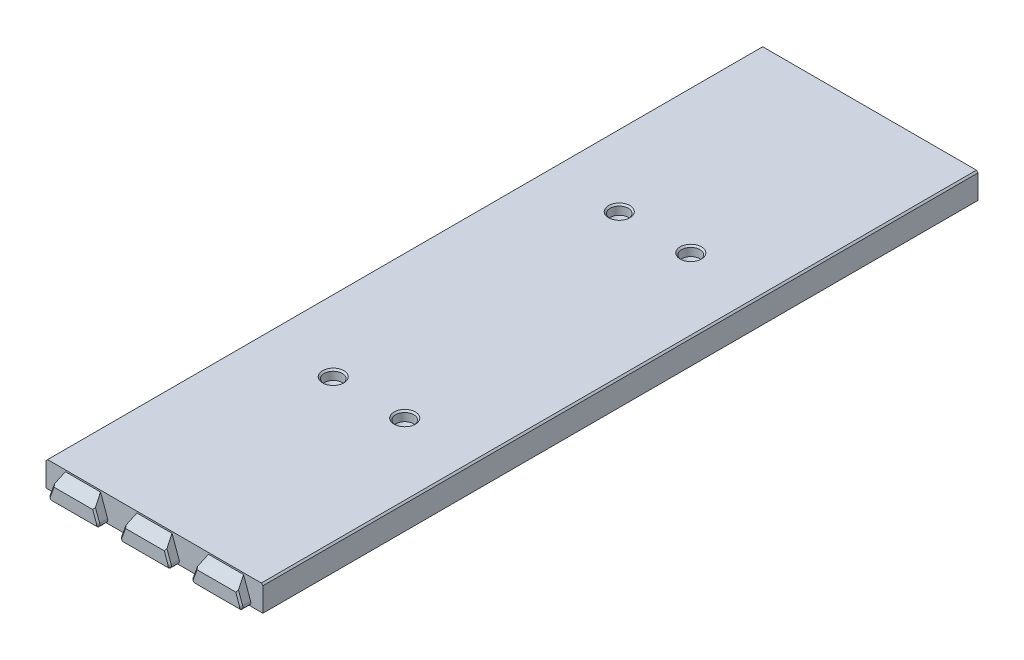
from build123d import *

# Parameters (mm, degrees)
BOSS_EXTRUDE1_DEPTH             = 112.5
SKETCH7_W                       = 64.25
SKETCH7_H                       = 6
BOSS_EXTRUDE7_DEPTH             = 1
BOSS_EXTRUDE4_DEPTH             = 3
BOSS_EXTRUDE8_REACH             = 119.834
BOSS_EXTRUDE8_DIRECTION_2_DEPTH = 2
CHAMFER4_SIZE                   = 0.5
FILLET4_R                       = 1
CHAMFER6_SIZE                   = 0.5
FILLET2_R                       = 2
CHAMFER4_OF_MIRROR2_SIZE        = 0.5
FILLET4_OF_MIRROR2_R            = 1
CHAMFER6_OF_MIRROR2_SIZE        = 0.5
FILLET2_OF_MIRROR2_R            = 2
BOSS_EXTRUDE9_REACH             = 232.678
SKETCH9_R                       = 5
FILLET3_R                       = 3
SKETCH10_R                      = 1.85
CUT_EXTRUDE2_DEPTH              = 231.678381356
SKETCH11_R                      = 2.85
CUT_EXTRUDE3_DEPTH              = 3
CHAMFER7_SIZE                   = 1
CUT_EXTRUDE4_DEPTH              = 231.678381356
CUT_EXTRUDE4_DEPTH_BACK         = 231.678381356
CHAMFER8_SIZE                   = 0.5


with BuildPart() as part:
    # Sketch1 → Boss-Extrude1 (new body)
    with BuildSketch(Plane.XY):
        Polygon((-34.125, 0), (-34.125, 8), (34.125, 8), (34.125, 0), (32.125, 0), (32.125, 6), (-32.125, 6), (-32.125, 0), align=None)
    boss_extrude1 = extrude(amount=-BOSS_EXTRUDE1_DEPTH)

    # Sketch7 → Boss-Extrude7 (add)
    with BuildSketch(Plane.XY):
        with Locations((0, 3)):
            Rectangle(SKETCH7_W, SKETCH7_H)
    boss_extrude7 = extrude(amount=-BOSS_EXTRUDE7_DEPTH)

    # Sketch2 → Boss-Extrude4 (add)
    with BuildSketch(Plane.XY):
        Polygon((17.161761874, 8), (14.25, 0), (30.75, 0), (27.838238126, 8), align=None)
        Polygon((-5.338238126, 8), (-8.25, 0), (8.25, 0), (5.338238126, 8), align=None)
        Polygon((-27.838238126, 8), (-30.75, 0), (-14.25, 0), (-17.161761874, 8), align=None)
    boss_extrude4 = extrude(amount=BOSS_EXTRUDE4_DEPTH)

    # Sketch8 → Boss-Extrude8 (add, up to next)
    with BuildSketch(Plane.XZ, mode=Mode.PRIVATE) as boss_extrude8_sk1:
        Polygon((-32.6, -24.741658736), (-32.6, -20.258341264), (-28.9, -21.605031131), (-28.9, -23.394968869), align=None)
    boss_extrude8_tool1 = extrude(boss_extrude8_sk1.sketch, amount=-BOSS_EXTRUDE8_REACH, mode=Mode.PRIVATE) - part.part
    # Sketch8 → Boss-Extrude8 (add, up to next)
    with BuildSketch(Plane.XZ, mode=Mode.PRIVATE) as boss_extrude8_sk2:
        Polygon((-32.6, -112.35), (-32.6, -110.258341264), (-28.9, -111.605031131), (-28.9, -112.35), (-28.9, -112.5), (-32.6, -112.5), align=None)
    boss_extrude8_tool2 = extrude(boss_extrude8_sk2.sketch, amount=-BOSS_EXTRUDE8_REACH, mode=Mode.PRIVATE) - part.part
    # Sketch8 → Boss-Extrude8 (add, up to next)
    with BuildSketch(Plane.XZ, mode=Mode.PRIVATE) as boss_extrude8_sk3:
        Polygon((32.6, -112.35), (32.6, -110.258341264), (28.9, -111.605031131), (28.9, -112.35), (28.9, -112.5), (32.6, -112.5), align=None)
    boss_extrude8_tool3 = extrude(boss_extrude8_sk3.sketch, amount=-BOSS_EXTRUDE8_REACH, mode=Mode.PRIVATE) - part.part
    # Sketch8 → Boss-Extrude8 (add, up to next)
    with BuildSketch(Plane.XZ, mode=Mode.PRIVATE) as boss_extrude8_sk4:
        Polygon((32.6, -24.741658736), (28.9, -23.394968869), (28.9, -21.605031131), (32.6, -20.258341264), align=None)
    boss_extrude8_tool4 = extrude(boss_extrude8_sk4.sketch, amount=-BOSS_EXTRUDE8_REACH, mode=Mode.PRIVATE) - part.part
    boss_extrude8_1 = boss_extrude8_tool1.solids().sort_by_distance((-31.014762, 0, -22.5))[0]
    add(boss_extrude8_1)
    boss_extrude8_2 = boss_extrude8_tool2.solids().sort_by_distance((-31.014762, 0, -111.66766))[0]
    add(boss_extrude8_2)
    boss_extrude8_3 = boss_extrude8_tool3.solids().sort_by_distance((31.014762, 0, -111.66766))[0]
    add(boss_extrude8_3)
    boss_extrude8_4 = boss_extrude8_tool4.solids().sort_by_distance((31.014762, 0, -22.5))[0]
    add(boss_extrude8_4)
    boss_extrude8 = boss_extrude8_1 + boss_extrude8_2 + boss_extrude8_3 + boss_extrude8_4  # Boss-Extrude8 as one shape, for the pattern or mirror that repeats it

    # Sketch8 → Boss-Extrude8 direction 2 (add)
    with BuildSketch(Plane.XZ):
        Polygon((-32.6, -24.741658736), (-32.6, -20.258341264), (-28.9, -21.605031131), (-28.9, -23.394968869), align=None)
        Polygon((-32.6, -112.35), (-32.6, -110.258341264), (-28.9, -111.605031131), (-28.9, -112.35), (-28.9, -112.5), (-32.6, -112.5), align=None)
        Polygon((32.6, -112.35), (32.6, -110.258341264), (28.9, -111.605031131), (28.9, -112.35), (28.9, -112.5), (32.6, -112.5), align=None)
        Polygon((32.6, -24.741658736), (28.9, -23.394968869), (28.9, -21.605031131), (32.6, -20.258341264), align=None)
    boss_extrude8_direction_2 = extrude(amount=BOSS_EXTRUDE8_DIRECTION_2_DEPTH)

    # Chamfer4
    chamfer4_edges = [part.edges().sort_by_distance(p)[0] for p in [
        (-32.6, -2, -111.379170632),
        (-28.9, -2, -112.052515565),
        (-30.75, -2, -110.931686197),
        (32.6, -2, -111.379170632),
        (30.75, -2, -110.931686197),
        (28.9, -2, -112.052515565),
        (32.6, -2, -22.5),
        (30.75, -2, -20.931686197),
        (28.9, -2, -22.5),
        (30.75, -2, -24.068313803),
        (-30.75, -2, -24.068313803),
        (-28.9, -2, -22.5),
        (-30.75, -2, -20.931686197),
        (-32.6, -2, -22.5),
    ]]
    chamfer(chamfer4_edges, length=CHAMFER4_SIZE)

    # Fillet4
    fillet4_edges = [part.edges().sort_by_distance(p)[0] for p in [
        (14.25, 0, 1.5),
        (30.75, 0, 1.5),
        (-8.25, 0, 1.5),
        (8.25, 0, 1.5),
        (-30.75, 0, 1.5),
        (-14.25, 0, 1.5),
    ]]
    fillet(fillet4_edges, radius=FILLET4_R)

    # Chamfer6
    chamfer6_edges = [part.edges().sort_by_distance(p)[0] for p in [
        (29.04989137, 4.671010072, 3),
        (22.5, 0, 3),
        (0, 0, 3),
        (-22.5, 0, 3),
        (14.858995962, 0.426423564, 3),
        (30.141004038, 0.426423564, 3),
        (6.54989137, 4.671010072, 3),
        (-7.641004038, 0.426423564, 3),
        (7.641004038, 0.426423564, 3),
        (-15.95010863, 4.671010072, 3),
        (-30.141004038, 0.426423564, 3),
        (-14.858995962, 0.426423564, 3),
        (15.95010863, 4.671010072, 3),
        (-6.54989137, 4.671010072, 3),
        (-29.04989137, 4.671010072, 3),
    ]]
    chamfer(chamfer6_edges, length=CHAMFER6_SIZE)

    # Fillet2
    fillet2_edges = [part.edges().sort_by_distance(p)[0] for p in [
        (-32.125, 6, -67.5),
        (-28.9, 6, -112.052515565),
        (-30.5125, 6, -111.018129128),
        (32.125, 6, -67.5),
        (30.5125, 6, -111.018129128),
        (28.9, 6, -112.052515565),
        (32.125, 6, -10.715613563),
        (30.5125, 6, -21.018129128),
        (30.5125, 6, -23.981870872),
        (28.9, 6, -22.5),
        (-32.125, 3, -1),
        (0, 6, -1),
        (32.125, 3, -1),
        (-32.125, 6, -10.715613563),
        (-30.5125, 6, -23.981870872),
        (-30.5125, 6, -21.018129128),
        (-28.9, 6, -22.5),
    ]]
    fillet(fillet2_edges, radius=FILLET2_R)


with BuildPart() as mirror2_1:
    # Mirror2: Boss-Extrude1, Boss-Extrude7, Boss-Extrude4, Boss-Extrude8, Boss-Extrude8 direction 2 across plane
    add(boss_extrude1.mirror(Plane.XY.offset(-112.5)))
    add(boss_extrude7.mirror(Plane.XY.offset(-112.5)))
    add(boss_extrude4.mirror(Plane.XY.offset(-112.5)))
    add(boss_extrude8.mirror(Plane.XY.offset(-112.5)))
    add(boss_extrude8_direction_2.mirror(Plane.XY.offset(-112.5)))

    # Chamfer4 of Mirror2
    chamfer4_of_mirror2_edges = [mirror2_1.edges().sort_by_distance(p)[0] for p in [
        (-32.6, -2, -113.620829368),
        (-28.9, -2, -112.947484435),
        (-30.75, -2, -114.068313803),
        (32.6, -2, -113.620829368),
        (30.75, -2, -114.068313803),
        (28.9, -2, -112.947484435),
        (32.6, -2, -202.5),
        (30.75, -2, -204.068313803),
        (28.9, -2, -202.5),
        (30.75, -2, -200.931686197),
        (-30.75, -2, -200.931686197),
        (-28.9, -2, -202.5),
        (-30.75, -2, -204.068313803),
        (-32.6, -2, -202.5),
    ]]
    chamfer(chamfer4_of_mirror2_edges, length=CHAMFER4_OF_MIRROR2_SIZE)

    # Fillet4 of Mirror2
    fillet4_of_mirror2_edges = [mirror2_1.edges().sort_by_distance(p)[0] for p in [
        (14.25, 0, -226.5),
        (30.75, 0, -226.5),
        (-8.25, 0, -226.5),
        (8.25, 0, -226.5),
        (-30.75, 0, -226.5),
        (-14.25, 0, -226.5),
    ]]
    fillet(fillet4_of_mirror2_edges, radius=FILLET4_OF_MIRROR2_R)

    # Chamfer6 of Mirror2
    chamfer6_of_mirror2_edges = [mirror2_1.edges().sort_by_distance(p)[0] for p in [
        (29.04989137, 4.671010072, -228),
        (22.5, 0, -228),
        (0, 0, -228),
        (-22.5, 0, -228),
        (14.858995962, 0.426423564, -228),
        (30.141004038, 0.426423564, -228),
        (6.54989137, 4.671010072, -228),
        (-7.641004038, 0.426423564, -228),
        (7.641004038, 0.426423564, -228),
        (-15.95010863, 4.671010072, -228),
        (-30.141004038, 0.426423564, -228),
        (-14.858995962, 0.426423564, -228),
        (15.95010863, 4.671010072, -228),
        (-6.54989137, 4.671010072, -228),
        (-29.04989137, 4.671010072, -228),
    ]]
    chamfer(chamfer6_of_mirror2_edges, length=CHAMFER6_OF_MIRROR2_SIZE)

    # Fillet2 of Mirror2
    fillet2_of_mirror2_edges = [mirror2_1.edges().sort_by_distance(p)[0] for p in [
        (-32.125, 6, -157.5),
        (-28.9, 6, -112.947484435),
        (-30.5125, 6, -113.981870872),
        (32.125, 6, -157.5),
        (30.5125, 6, -113.981870872),
        (28.9, 6, -112.947484435),
        (32.125, 6, -214.284386437),
        (30.5125, 6, -203.981870872),
        (30.5125, 6, -201.018129128),
        (28.9, 6, -202.5),
        (-32.125, 3, -224),
        (0, 6, -224),
        (32.125, 3, -224),
        (-32.125, 6, -214.284386437),
        (-30.5125, 6, -201.018129128),
        (-30.5125, 6, -203.981870872),
        (-28.9, 6, -202.5),
    ]]
    fillet(fillet2_of_mirror2_edges, radius=FILLET2_OF_MIRROR2_R)


with BuildPart() as part_1:
    add(part.part)

    # Mirror2 united with what the copies touc: union Mirror2_1
    add(mirror2_1.part)

    # Sketch9 → Boss-Extrude9 (add, up to next)
    with BuildSketch(Plane(origin=(0, 0, 0), x_dir=(1, 0, 0), z_dir=(0, 1, 0)), mode=Mode.PRIVATE) as boss_extrude9_sk1:
        with Locations(Location((-11.25, 67.5, 0), (0, 0, 90))):
            Circle(SKETCH9_R)
    boss_extrude9_tool1 = extrude(boss_extrude9_sk1.sketch, amount=BOSS_EXTRUDE9_REACH, mode=Mode.PRIVATE) - part_1.part
    # Sketch9 → Boss-Extrude9 (add, up to next)
    with BuildSketch(Plane(origin=(0, 0, 0), x_dir=(1, 0, 0), z_dir=(0, 1, 0)), mode=Mode.PRIVATE) as boss_extrude9_sk2:
        with Locations(Location((11.25, 67.5, 0), (0, 0, 90))):
            Circle(SKETCH9_R)
    boss_extrude9_tool2 = extrude(boss_extrude9_sk2.sketch, amount=BOSS_EXTRUDE9_REACH, mode=Mode.PRIVATE) - part_1.part
    # Sketch9 → Boss-Extrude9 (add, up to next)
    with BuildSketch(Plane(origin=(0, 0, 0), x_dir=(1, 0, 0), z_dir=(0, 1, 0)), mode=Mode.PRIVATE) as boss_extrude9_sk3:
        with Locations(Location((11.25, 157.5, 0), (0, 0, 90))):
            Circle(SKETCH9_R)
    boss_extrude9_tool3 = extrude(boss_extrude9_sk3.sketch, amount=BOSS_EXTRUDE9_REACH, mode=Mode.PRIVATE) - part_1.part
    # Sketch9 → Boss-Extrude9 (add, up to next)
    with BuildSketch(Plane(origin=(0, 0, 0), x_dir=(1, 0, 0), z_dir=(0, 1, 0)), mode=Mode.PRIVATE) as boss_extrude9_sk4:
        with Locations(Location((-11.25, 157.5, 0), (0, 0, 90))):
            Circle(SKETCH9_R)
    boss_extrude9_tool4 = extrude(boss_extrude9_sk4.sketch, amount=BOSS_EXTRUDE9_REACH, mode=Mode.PRIVATE) - part_1.part
    add(boss_extrude9_tool1.solids().sort_by_distance((-11.25, 0, -67.5))[0])
    add(boss_extrude9_tool2.solids().sort_by_distance((11.25, 0, -67.5))[0])
    add(boss_extrude9_tool3.solids().sort_by_distance((11.25, 0, -157.5))[0])
    add(boss_extrude9_tool4.solids().sort_by_distance((-11.25, 0, -157.5))[0])

    # Fillet3
    fillet3_edges = [part_1.edges().sort_by_distance(p)[0] for p in [
        (-11.25, 6, -62.5),
        (-11.25, 6, -152.5),
        (11.25, 6, -152.5),
        (11.25, 6, -62.5),
    ]]
    fillet(fillet3_edges, radius=FILLET3_R)

    # Sketch10 → Cut-Extrude2 (cut, through all)
    with BuildSketch(Plane(origin=(0, 0, 0), x_dir=(1, 0, 0), z_dir=(0, 1, 0))):
        with Locations(Location((-11.25, 157.5, 0), (0, 0, 270))):
            Circle(SKETCH10_R)
        with Locations(Location((-11.25, 67.5, 0), (0, 0, 270))):
            Circle(SKETCH10_R)
        with Locations(Location((11.25, 67.5, 0), (0, 0, 270))):
            Circle(SKETCH10_R)
        with Locations(Location((11.25, 157.5, 0), (0, 0, 270))):
            Circle(SKETCH10_R)
    extrude(amount=CUT_EXTRUDE2_DEPTH, mode=Mode.SUBTRACT)

    # Sketch11 → Cut-Extrude3 (cut)
    with BuildSketch(Plane(origin=(0, 8, 0), x_dir=(1, 0, 0), z_dir=(0, 1, 0))):
        with Locations(Location((-11.25, 157.5, 0), (0, 0, 270))):
            Circle(SKETCH11_R)
        with Locations(Location((11.25, 157.5, 0), (0, 0, 270))):
            Circle(SKETCH11_R)
        with Locations(Location((11.25, 67.5, 0), (0, 0, 270))):
            Circle(SKETCH11_R)
        with Locations(Location((-11.25, 67.5, 0), (0, 0, 270))):
            Circle(SKETCH11_R)
    extrude(amount=-CUT_EXTRUDE3_DEPTH, mode=Mode.SUBTRACT)

    # Chamfer7
    chamfer7_edges = [part_1.edges().sort_by_distance(p)[0] for p in [
        (-11.25, 5, -69.35),
        (11.25, 5, -69.35),
        (11.25, 5, -159.35),
        (-11.25, 5, -159.35),
    ]]
    chamfer(chamfer7_edges, length=CHAMFER7_SIZE - 0.0001)  # a hair under: the kernel refuses the full size

    # Sketch12 → Cut-Extrude4 (cut, two sides: drawn at the far end of the back side and taken through both)
    with BuildSketch(Plane(origin=(0, 0, 0), x_dir=(0, 0, -1), z_dir=(1, 0, 0)).offset(-CUT_EXTRUDE4_DEPTH_BACK)):
        Polygon((0, 7.5), (-3, 4.5), (-3, 7.5), (-3, 8), (0, 8), align=None)
        Polygon((228, 8), (228, 7.5), (228, 4.5), (225, 7.5), (225, 8), align=None)
    extrude(amount=CUT_EXTRUDE4_DEPTH + CUT_EXTRUDE4_DEPTH_BACK, mode=Mode.SUBTRACT)

    # Chamfer8
    chamfer8_edges = [part_1.edges().sort_by_distance(p)[0] for p in [
        (-34.125, 8, -112.5),
        (34.125, 8, -112.5),
        (-11.25, 8, -70.35),
        (11.25, 8, -70.35),
        (11.25, 8, -160.35),
        (-11.25, 8, -160.35),
    ]]
    chamfer(chamfer8_edges, length=CHAMFER8_SIZE)


solid = part_1.part
